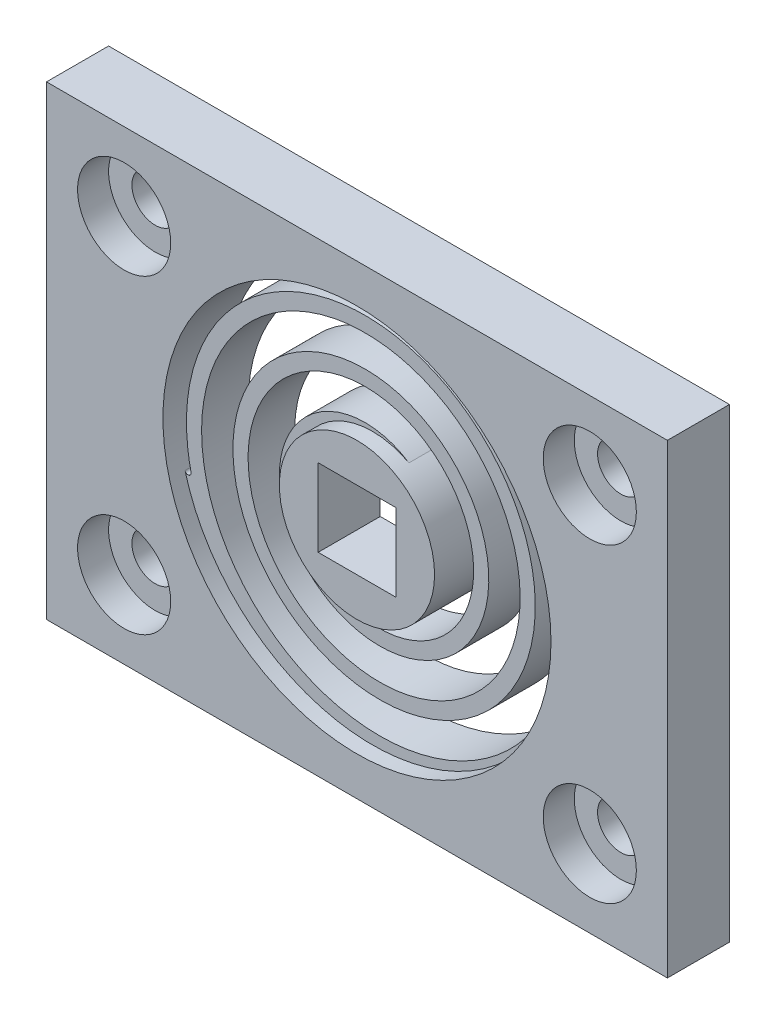
from build123d import *

# Parameters (mm, degrees)
SKIZZE1_W                       = 40
SKIZZE1_H                       = 30
AUFSATZ_LINEAR_AUSTRAGEN1_DEPTH = 4
SCHNITT_LINEAR_AUSTRAGEN3_REACH = 52.16
SKIZZE5_R                       = 12.5
SKIZZE5_R_2                     = 5
SKIZZE8_R                       = 3
SKIZZE8_R_2                     = 1.5
SCHNITT_LINEAR_AUSTRAGEN6_DEPTH = 2
SKIZZE8_3_R                     = 1.5
SCHNITT_LINEAR_AUSTRAGEN7_DEPTH = 4
AUSTRAGUNG3_DEPTH               = 3
VERRUNDUNG2_R                   = 0.2
SCHNITT_LINEAR_AUSTRAGEN8_REACH = 52.16
SKIZZE17_W                      = 5
SKIZZE17_H                      = 5


# Read off the part's stored shape, not the designer's step: Austragung3
with BuildPart() as part:
    # Skizze1 → Aufsatz-Linear austragen1 (new body)
    with BuildSketch(Plane.XY):
        with Locations((20, 15)):
            Rectangle(SKIZZE1_W, SKIZZE1_H)
    extrude(amount=AUFSATZ_LINEAR_AUSTRAGEN1_DEPTH)

    # Skizze5 → Schnitt-Linear austragen3 (cut, up to next)
    with BuildSketch(Plane.XY.offset(4), mode=Mode.PRIVATE) as schnitt_linear_austragen3_sk1:
        with Locations((20, 15)):
            Circle(SKIZZE5_R)
        with Locations((20, 15)):
            Circle(SKIZZE5_R_2, mode=Mode.SUBTRACT)
    schnitt_linear_austragen3_tool1 = extrude(schnitt_linear_austragen3_sk1.sketch, amount=-SCHNITT_LINEAR_AUSTRAGEN3_REACH, mode=Mode.PRIVATE) & part.part
    add(schnitt_linear_austragen3_tool1.solids().sort_by_distance((7.853553, 15, 4))[0], mode=Mode.SUBTRACT)


with BuildPart() as schnitt_linear_austragen3_piece_1:
    # of the separate pieces the step leaves, piece 1, a body of its own (schnitt_linear_austragen3_pieces)
    add(part.part.solids().sort_by_distance((0, 0, 0))[0])

    # Skizze8 → Schnitt-Linear austragen6 (cut)
    # profile 1 of 4: a face of its own
    with BuildSketch(Plane.XY.offset(4)):
        with Locations((5, 25)):
            Circle(SKIZZE8_R)
        with Locations((5, 25)):
            Circle(SKIZZE8_R_2, mode=Mode.SUBTRACT)
    # profile 2 of 4: a face of its own
    with BuildSketch(Plane.XY.offset(4)):
        with Locations((5, 5)):
            Circle(SKIZZE8_R)
        with Locations((5, 5)):
            Circle(SKIZZE8_R_2, mode=Mode.SUBTRACT)
    # profile 3 of 4: a face of its own
    with BuildSketch(Plane.XY.offset(4)):
        with Locations((35, 5)):
            Circle(SKIZZE8_R)
        with Locations((35, 5)):
            Circle(SKIZZE8_R_2, mode=Mode.SUBTRACT)
    # profile 4 of 4: a face of its own
    with BuildSketch(Plane.XY.offset(4)):
        with Locations((35, 25)):
            Circle(SKIZZE8_R)
        with Locations((35, 25)):
            Circle(SKIZZE8_R_2, mode=Mode.SUBTRACT)
    extrude(amount=-SCHNITT_LINEAR_AUSTRAGEN6_DEPTH, mode=Mode.SUBTRACT)

    # Skizze8<3> → Schnitt-Linear austragen7 (cut)
    with BuildSketch(Plane.XY.offset(4)):
        with Locations((5, 25)):
            Circle(SKIZZE8_3_R)
        with Locations((5, 5)):
            Circle(SKIZZE8_3_R)
        with Locations((35, 5)):
            Circle(SKIZZE8_3_R)
        with Locations((35, 25)):
            Circle(SKIZZE8_3_R)
    extrude(amount=-SCHNITT_LINEAR_AUSTRAGEN7_DEPTH, mode=Mode.SUBTRACT)



with BuildPart() as schnitt_linear_austragen3_piece_2:
    # of the separate pieces the step leaves, piece 2, a body of its own (schnitt_linear_austragen3_pieces)
    add(part.part.solids().sort_by_distance((25, 15, 0))[0])


with BuildPart() as schnitt_linear_austragen3_piece_1_1:
    add(schnitt_linear_austragen3_piece_1.part)

    add(schnitt_linear_austragen3_piece_2.part)  # Austragung3 merges Schnitt-Linear austragen3 piece 2
    # Austragung3 outline → Austragung3 (add)
    with BuildSketch(Plane.XY):
        with BuildLine():
            ThreePointArc((15.00000018, 14.998659576), (17.42518097, 19.286059608), (22.349306116, 19.413701482))
            add(Edge.make_bspline(
                [(22.349306116, 19.413701482), (22.216520244, 19.501407181), (21.830098608, 19.730975714), (21.410473966, 19.909685311), (20.849463367, 20.09234631), (20.26798133, 20.22741462), (19.662909626, 20.261338126), (19.054675024, 20.242012194), (18.443396861, 20.16938524), (17.844897507, 19.990546946), (17.262077074, 19.759067332), (16.695069225, 19.474939888), (16.17775592, 19.092561984), (15.694099647, 18.664785764), (15.244231517, 18.191653197), (14.876884319, 17.640979395), (14.55799013, 17.058236973), (14.287660114, 16.443513543), (14.124228248, 15.782792022), (14.018828569, 15.108068598), (13.971536651, 14.41946753), (14.043557931, 13.723859806), (14.176496085, 13.035035891), (14.370379354, 12.353142455), (14.681850271, 11.70618519), (15.049721945, 11.0870547), (15.473969144, 10.495902206), (15.999433405, 9.979489855), (16.569572202, 9.509590232), (17.184307346, 9.086339803), (17.870554961, 8.770427378), (18.583645659, 8.514913194), (19.323455692, 8.319900657), (20.094783417, 8.253213859), (20.870938607, 8.254053472), (21.651765577, 8.322474955), (22.418296428, 8.525442788), (23.165986915, 8.795105072), (23.894667759, 9.131459914), (24.562819682, 9.592355628), (25.189663105, 10.11088872), (25.775036065, 10.686997461), (26.258921149, 11.361910526), (26.683057999, 12.077924883), (27.047312871, 12.83492402), (27.279681586, 13.651729834), (27.440342123, 14.487328381), (27.529207166, 15.341560607), (27.470553265, 16.207560016), (27.336464087, 17.066765156), (27.126911853, 17.918992596), (26.771528764, 18.731421048), (26.346024578, 19.511193166), (25.850437167, 20.25812316), (25.228550181, 20.91633968), (24.550623338, 21.518923067), (23.816758239, 22.065708396), (22.992312182, 22.483619442), (22.13330921, 22.828737762), (21.239904636, 23.100940842), (20.304111254, 23.218130172), (19.360315889, 23.253516566), (18.408710391, 23.207036992), (17.469990119, 22.997176352), (16.551851761, 22.706073685), (15.654501276, 22.333735739), (14.825924299, 21.809135934), (14.045134263, 21.213728235), (13.312326169, 20.547591137), (12.698007105, 19.759189492), (12.153934536, 18.919391522), (11.680267853, 18.028340548), (11.362349452, 17.060959576), (11.129481509, 16.068544446), (10.98176666, 15.051288056), (11.009612595, 14.014577756), (11.127577108, 12.983196773), (11.335691213, 11.9573656), (11.71869185, 10.973387825), (12.186176946, 10.025561643), (12.738099372, 9.114108939), (13.443097709, 8.30296798), (14.216548249, 7.555537221), (15.058328653, 6.872012613), (16.01213976, 6.337223285), (17.009553157, 5.886985692), (18.05038363, 5.521444777), (19.147271612, 5.336817384), (20.256800736, 5.248112602), (21.378743449, 5.255404718), (22.492107947, 5.455098355), (23.584580427, 5.750919966), (24.65591746, 6.142861575), (25.652902441, 6.715922437), (26.596857924, 7.373755824), (27.487553909, 8.116269631), (28.244893433, 9.006464309), (28.922388468, 9.959509097), (29.519851075, 10.975236177), (29.939063026, 12.086368531), (30.260345096, 13.230167389), (30.483575815, 14.40640722), (30.503635746, 15.61264428), (30.418867949, 16.816481009), (30.229234458, 18.017659815), (29.835109036, 19.177768545), (29.341635485, 20.299596184), (28.748866697, 21.382883482), (27.974698591, 22.35678897), (26.976263877, 23.410485695), (26.011805531, 24.219032699), (24.920281868, 24.852809125), (24.168641042, 25.232873155), (23.005384359, 25.739175111), (21.75861341, 26.044172507), (20.062968032, 26.255827089), (18.766620939, 26.268192643), (17.483890826, 26.058474697), (16.637513209, 25.869243945), (15.381298092, 25.511273312), (14.190493322, 24.938710537), (12.703971152, 23.998632227), (11.66534831, 23.161214095), (10.782846676, 22.156388763), (10.233811014, 21.453012649), (9.469351813, 20.347836157), (8.897168603, 19.115082967), (8.330114229, 17.397397156), (8.051907523, 16.053963886), (8.007000895, 14.679770552), (8.030133771, 13.762756925), (8.144471456, 12.386105677), (8.494710249, 11.033885094), (9.165390571, 9.300187284), (9.821098849, 8.052257993), (10.681874929, 6.932318309), (11.298380987, 6.219649623), (12.287019732, 5.201759852), (13.446734199, 4.3572557), (14.289046308, 3.881953979), (14.3001077, 3.875734642), (14.311179272, 3.869531963)],
                knots=[0.190993157, 0.190993157, 0.190993157, 0.190993157, 0.1953125, 0.203125, 0.203125, 0.2109375, 0.21875, 0.21875, 0.2265625, 0.234375, 0.234375, 0.2421875, 0.25, 0.25, 0.2578125, 0.265625, 0.265625, 0.2734375, 0.28125, 0.28125, 0.2890625, 0.296875, 0.296875, 0.3046875, 0.3125, 0.3125, 0.3203125, 0.328125, 0.328125, 0.3359375, 0.34375, 0.34375, 0.3515625, 0.359375, 0.359375, 0.3671875, 0.375, 0.375, 0.3828125, 0.390625, 0.390625, 0.3984375, 0.40625, 0.40625, 0.4140625, 0.421875, 0.421875, 0.4296875, 0.4375, 0.4375, 0.4453125, 0.453125, 0.453125, 0.4609375, 0.46875, 0.46875, 0.4765625, 0.484375, 0.484375, 0.4921875, 0.5, 0.5, 0.5078125, 0.515625, 0.515625, 0.5234375, 0.53125, 0.53125, 0.5390625, 0.546875, 0.546875, 0.5546875, 0.5625, 0.5625, 0.5703125, 0.578125, 0.578125, 0.5859375, 0.59375, 0.59375, 0.6015625, 0.609375, 0.609375, 0.6171875, 0.625, 0.625, 0.6328125, 0.640625, 0.640625, 0.6484375, 0.65625, 0.65625, 0.6640625, 0.671875, 0.671875, 0.6796875, 0.6875, 0.6875, 0.6953125, 0.703125, 0.703125, 0.7109375, 0.71875, 0.71875, 0.7265625, 0.734375, 0.734375, 0.7421875, 0.75, 0.75, 0.760416667, 0.765625, 0.765625, 0.770833333, 0.78125, 0.78125, 0.791666667, 0.796875, 0.796875, 0.802083333, 0.8125, 0.8125, 0.822916667, 0.828125, 0.828125, 0.833333333, 0.84375, 0.84375, 0.854166667, 0.859375, 0.859375, 0.864583333, 0.875, 0.875, 0.885416667, 0.890625, 0.890625, 0.895833333, 0.90625, 0.90625, 0.906388484, 0.906388484, 0.906388484, 0.906388484], degree=3))
            ThreePointArc((14.311179272, 3.869531963), (26.524559023, 4.337911577), (32.5, 15))
            add(Edge.make_bspline(
                [(15.00000018, 14.998659576), (14.988391904, 14.876357874), (14.964559871, 14.464826609), (14.991486115, 14.047540628), (15.080850278, 13.465709094), (15.221870082, 12.887013274), (15.463504458, 12.332563964), (15.754097762, 11.79922545), (16.093624763, 11.287148951), (16.522043121, 10.834012849), (16.990419141, 10.418555129), (17.498674634, 10.040912255), (18.072213253, 9.751580523), (18.671155524, 9.512745085), (19.295377702, 9.324509348), (19.951708948, 9.244604094), (20.614869354, 9.222429623), (21.284703237, 9.258041393), (21.947569897, 9.409602838), (22.596795862, 9.619327714), (23.23221185, 9.887214128), (23.820286896, 10.264639252), (24.374830975, 10.693441546), (24.895682126, 11.173559285), (25.332524579, 11.742840348), (25.719051265, 12.349969293), (26.055128436, 12.994829609), (26.279019053, 13.696347177), (26.44117263, 14.416790628), (26.541501853, 15.156000909), (26.513903615, 15.910683138), (26.42020227, 16.662070484), (26.260370039, 17.409979519), (25.971878801, 18.128202416), (25.620859443, 18.820217486), (25.207349835, 19.485838939), (24.68027046, 20.078067295), (24.102111567, 20.623296169), (23.47297476, 21.121360637), (22.760048922, 21.509266533), (22.014311969, 21.834178265), (21.235919213, 22.095973316), (20.415197467, 22.22265625), (19.584802533, 22.27734375), (18.744926263, 22.259972784), (17.911262516, 22.097962307), (17.093292627, 21.863370784), (16.291222555, 21.556204964), (15.545312911, 21.112152374), (14.839663876, 20.60378731), (14.174470453, 20.031188266), (13.610702912, 19.346525797), (13.107905643, 18.614033883), (12.666238035, 17.833855846), (12.36081772, 16.981178313), (12.130515034, 16.103687404), (11.975432615, 15.20157602), (11.976268993, 14.277024654), (12.057803901, 13.354653782), (12.220068353, 12.434683897), (12.53974747, 11.547120972), (12.936111708, 10.689564018), (13.409113938, 9.862234919), (14.02194407, 9.120426289), (14.697964111, 8.433910277), (15.43705172, 7.802882832), (16.28070121, 7.302197448), (17.165845011, 6.876365558), (18.09229791, 6.525532103), (19.073993391, 6.33578181), (20.069622356, 6.232116243), (21.078957253, 6.214609687), (22.085644938, 6.370569121), (23.075979479, 6.613835534), (24.049717443, 6.944400948), (24.961079592, 7.440269981), (25.8266625, 8.014143629), (26.646236167, 8.665929788), (27.349064434, 9.454558018), (27.981156543, 10.302115811), (28.542324553, 11.208435348), (28.944533939, 12.20556926), (29.258708797, 13.234755801), (29.484727655, 14.295769439), (29.527281636, 15.388973596), (29.474526739, 16.482541177), (29.326425, 17.57621459), (28.991642117, 18.637532501), (28.565524935, 19.666389079), (28.048126342, 20.662525076), (27.363232903, 21.563456124), (26.47527488, 22.541643918), (25.612737029, 23.296472315), (24.630941287, 23.894851809), (23.953563324, 24.255558217), (22.90336731, 24.739184242), (21.771847851, 25.041347038), (20.228314419, 25.266641291), (19.044883752, 25.302300952), (17.869355977, 25.134986922), (17.092601855, 24.978004843), (15.938054887, 24.674376314), (14.838029791, 24.172860393), (13.460272176, 23.339968316), (12.494016493, 22.592282677), (11.667332417, 21.688310601), (11.15155648, 21.054069834), (10.431058895, 20.055446129), (9.883819079, 18.935223556), (9.332633004, 17.369396778), (9.053285354, 16.14122144), (8.987397071, 14.880357745), (8.992284355, 14.037853373), (9.072866917, 12.771400246), (9.370870892, 11.521911526), (9.957324568, 9.915546675), (10.538927696, 8.75588496), (11.311505511, 7.710120938), (11.866588471, 7.043392166), (12.759156187, 6.089146474), (13.81327445, 5.290783569), (15.329869455, 4.397467312), (16.550324987, 3.85612148), (17.8478154, 3.530189353), (18.724652423, 3.36326561), (20.057475427, 3.188498307), (21.416498594, 3.243148903), (23.204703409, 3.524499767), (24.527561216, 3.89187637), (25.770654411, 4.480502388), (26.575844305, 4.920608962), (27.748117489, 5.652229806), (28.791184918, 6.58292031), (30.026788306, 7.973568178), (30.836788548, 9.128570816), (31.438998576, 10.4068456), (31.790658907, 11.281450048), (32.243316992, 12.626797864), (32.463541667, 14.045523065), (32.5, 15)],
                knots=[0.285726122, 0.285726122, 0.285726122, 0.285726122, 0.2890625, 0.296875, 0.296875, 0.3046875, 0.3125, 0.3125, 0.3203125, 0.328125, 0.328125, 0.3359375, 0.34375, 0.34375, 0.3515625, 0.359375, 0.359375, 0.3671875, 0.375, 0.375, 0.3828125, 0.390625, 0.390625, 0.3984375, 0.40625, 0.40625, 0.4140625, 0.421875, 0.421875, 0.4296875, 0.4375, 0.4375, 0.4453125, 0.453125, 0.453125, 0.4609375, 0.46875, 0.46875, 0.4765625, 0.484375, 0.484375, 0.4921875, 0.5, 0.5, 0.5078125, 0.515625, 0.515625, 0.5234375, 0.53125, 0.53125, 0.5390625, 0.546875, 0.546875, 0.5546875, 0.5625, 0.5625, 0.5703125, 0.578125, 0.578125, 0.5859375, 0.59375, 0.59375, 0.6015625, 0.609375, 0.609375, 0.6171875, 0.625, 0.625, 0.6328125, 0.640625, 0.640625, 0.6484375, 0.65625, 0.65625, 0.6640625, 0.671875, 0.671875, 0.6796875, 0.6875, 0.6875, 0.6953125, 0.703125, 0.703125, 0.7109375, 0.71875, 0.71875, 0.7265625, 0.734375, 0.734375, 0.7421875, 0.75, 0.75, 0.760416667, 0.765625, 0.765625, 0.770833333, 0.78125, 0.78125, 0.791666667, 0.796875, 0.796875, 0.802083333, 0.8125, 0.8125, 0.822916667, 0.828125, 0.828125, 0.833333333, 0.84375, 0.84375, 0.854166667, 0.859375, 0.859375, 0.864583333, 0.875, 0.875, 0.885416667, 0.890625, 0.890625, 0.895833333, 0.90625, 0.90625, 0.916666667, 0.921875, 0.921875, 0.927083333, 0.9375, 0.9375, 0.947916667, 0.953125, 0.953125, 0.958333333, 0.96875, 0.96875, 0.979166667, 0.984375, 0.984375, 0.989583333, 1, 1, 1, 1], degree=3))
        make_face()
    extrude(amount=AUSTRAGUNG3_DEPTH)

    # Verrundung2
    verrundung2_edges = [schnitt_linear_austragen3_piece_1_1.edges().sort_by_distance(p)[0] for p in [
        (15.00000018, 14.998659576, 1.5),
        (14.311179272, 3.869531963, 1.5),
    ]]
    fillet(verrundung2_edges, radius=VERRUNDUNG2_R)

    # Skizze17 → Schnitt-Linear austragen8 (cut, up to next)
    with BuildSketch(Plane.XY.offset(4), mode=Mode.PRIVATE) as schnitt_linear_austragen8_sk1:
        with Locations((20, 15)):
            Rectangle(SKIZZE17_W, SKIZZE17_H)
    schnitt_linear_austragen8_tool1 = extrude(schnitt_linear_austragen8_sk1.sketch, amount=-SCHNITT_LINEAR_AUSTRAGEN8_REACH, mode=Mode.PRIVATE) & schnitt_linear_austragen3_piece_1_1.part
    add(schnitt_linear_austragen8_tool1.solids().sort_by_distance((20, 15, 4))[0], mode=Mode.SUBTRACT)


solid = schnitt_linear_austragen3_piece_1_1.part
